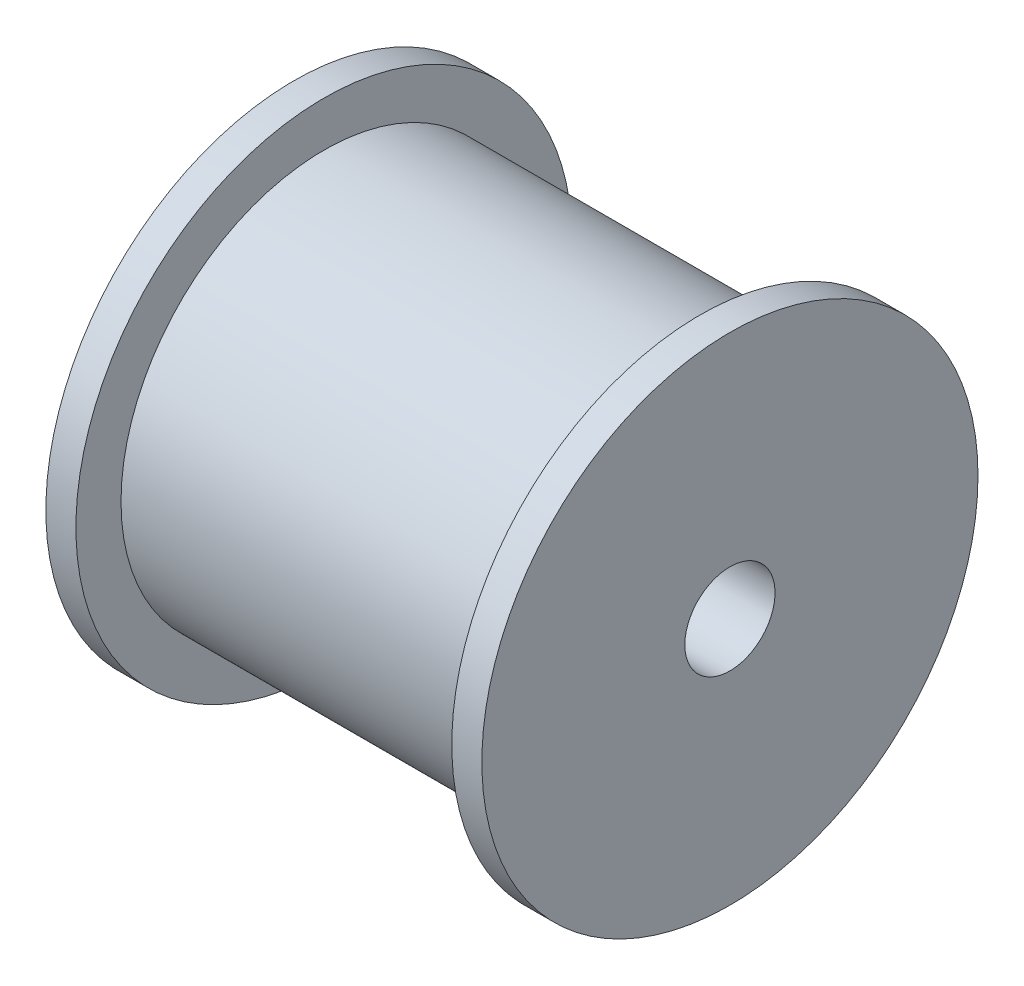
from build123d import *

# Parameters (mm, degrees)
SKETCH1_R           = 135
BOSS_EXTRUDE1_DEPTH = 250
SKETCH2_R           = 165
BOSS_EXTRUDE2_DEPTH = 20
SKETCH3_R           = 30
CUT_EXTRUDE1_DEPTH  = 373.223051409


with BuildPart() as part:
    # Sketch1 → Boss-Extrude1 (new body)
    with BuildSketch(Plane(origin=(0, 0, 0), x_dir=(0, 0, -1), z_dir=(1, 0, 0))):
        Circle(SKETCH1_R)
    extrude(amount=BOSS_EXTRUDE1_DEPTH)

    # Sketch2 → Boss-Extrude2 (add)
    with BuildSketch(Plane(origin=(0, 0, 0), x_dir=(0, 0, -1), z_dir=(1, 0, 0))):
        Circle(SKETCH2_R)
    boss_extrude2 = extrude(amount=-BOSS_EXTRUDE2_DEPTH)

    # Mirror1: Boss-Extrude2 across plane
    add(boss_extrude2.mirror(Plane(origin=(125, 0, 0), x_dir=(0, 0, 1), z_dir=(1, 0, 0))))

    # Sketch3 → Cut-Extrude1 (cut, through all)
    with BuildSketch(Plane.ZY.offset(20)):
        Circle(SKETCH3_R)
    extrude(amount=-CUT_EXTRUDE1_DEPTH, mode=Mode.SUBTRACT)


solid = part.part
